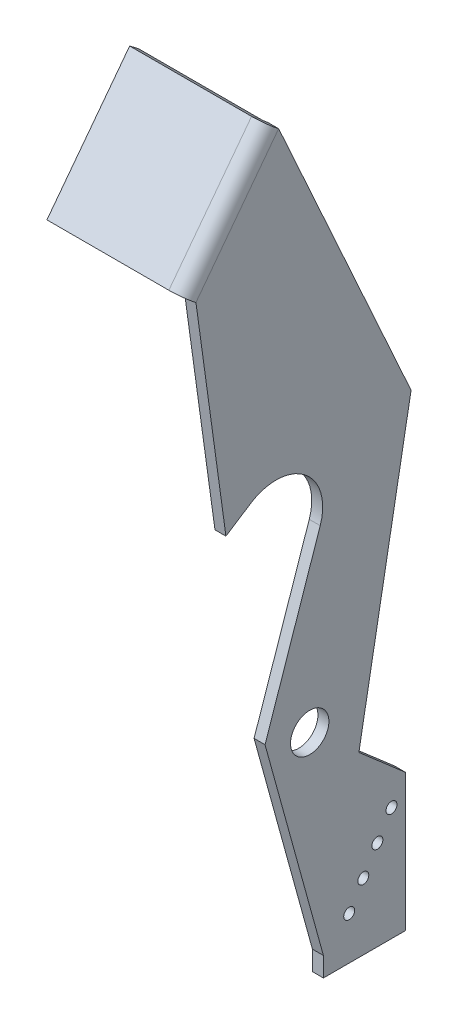
from build123d import *

# Parameters (mm, degrees)
SKETCH_6_R             = 7
SKETCH_6_R_2           = 2
SM_BASE_FLANGE_2_DEPTH = 4
SM_EDGE_FLANGE_1_DEPTH = 50


# Sheet-metal steps are written as plain solids
with BuildPart() as part:
    # Эскиз6 → Базовая кромка2 (new body)
    with BuildSketch(Plane(origin=(0, 0, 0), x_dir=(0, 0, -1), z_dir=(1, 0, 0))):
        with BuildLine():
            Line((-41.515639953, 156.639911011), (-30.570860008, 77.324503301))
            Line((-30.570860008, 77.324503301), (-21.473166605, 83.200308456))
            ThreePointArc((-21.473166605, 83.200308456), (-1.78992877, 82.320794398), (3.842668301, 63.440189352))
            Line((3.842668301, 63.440189352), (-16.29997452, 4.284628471))
            Line((-16.29997452, 4.284628471), (5, -72.987711453))
            Line((5, -72.987711453), (5, -80.109264525))
            Line((5, -80.109264525), (35, -80.109264525))
            Line((35, -80.109264525), (35, -30.109264525))
            Line((35, -30.109264525), (17.952200663, -15.286686185))
            Line((17.952200663, -15.286686185), (37, 89.665096307))
            Line((37, 89.665096307), (-11.325084854, 196.496282933))
            Line((-11.325084854, 196.496282933), (-41.515639953, 156.639911011))
        make_face()
        Circle(SKETCH_6_R, mode=Mode.SUBTRACT)
        with Locations((29.855042446, -38.684193782)):
            Circle(SKETCH_6_R_2, mode=Mode.SUBTRACT)
        with Locations((24.710084891, -47.259123039)):
            Circle(SKETCH_6_R_2, mode=Mode.SUBTRACT)
        with Locations((19.565127337, -55.834052297)):
            Circle(SKETCH_6_R_2, mode=Mode.SUBTRACT)
        with Locations((14.420169783, -64.408981554)):
            Circle(SKETCH_6_R_2, mode=Mode.SUBTRACT)
    extrude(amount=-SM_BASE_FLANGE_2_DEPTH)

    # Ребро-кромка1 section (across the edge) → Ребро-кромка1 (add)
    with BuildSketch(Plane(origin=(-4, 157.545627664, 42.711331111), x_dir=(-3.4914813388431334e-15, -0.6038111019965894, -0.7971274384348241), z_dir=(0, 0.7971274384348241, -0.6038111019965894))):
        with BuildLine():
            Line((-4, 1.5), (-4, 46))
            Line((-4, 46), (0, 46))
            Line((0, 46), (0, 1.5))
            ThreePointArc((0, 1.5), (0.439339828, 0.439339828), (1.5, 0))
            Line((1.5, 0), (1.5, -4))
            ThreePointArc((1.5, -4), (-2.389087297, -2.389087297), (-4, 1.5))
        make_face()
    extrude(amount=SM_EDGE_FLANGE_1_DEPTH)


solid = part.part
